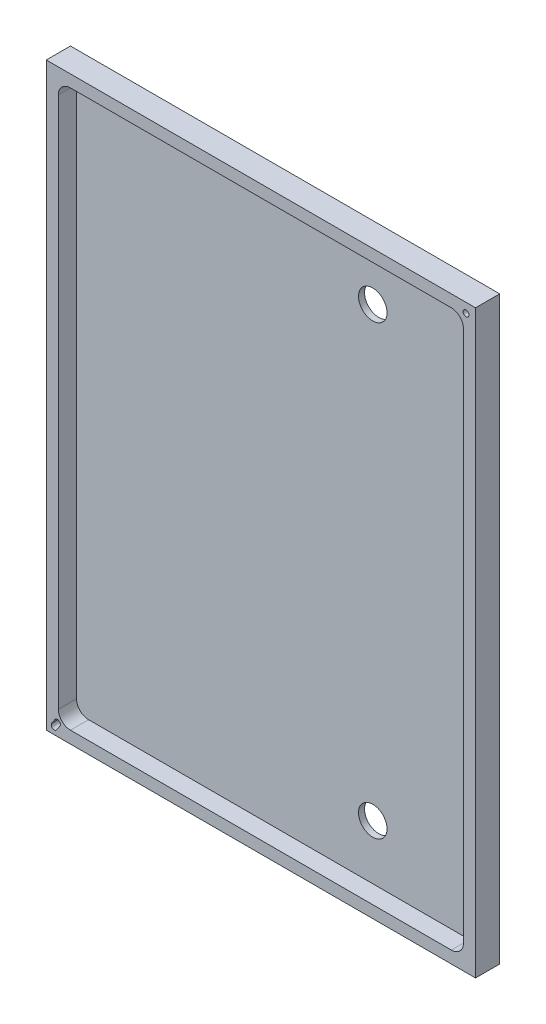
from build123d import *

# Parameters (mm, degrees)
SKETCH1_W                      = 225.425
SKETCH1_H                      = 304.8
BOSS_EXTRUDE1_DEPTH            = 12.7
CUT_EXTRUDE1_DEPTH             = 9.525
SKETCH4_R                      = 7.5
CUT_EXTRUDE3_DEPTH             = 190.976729249
F_3_1_3_1_DIAMETER_HOLE1_D     = 3.1
F_3_1_3_1_DIAMETER_HOLE1_DEPTH = 5
F_3_1_3_1_DIAMETER_HOLE1_TIP   = 0.931333959
CUT_EXTRUDE4_DEPTH             = 5
M4X0_7_TAPPED_HOLE1_D          = 3.3
M4X0_7_TAPPED_HOLE1_DEPTH      = 5.4
M4X0_7_TAPPED_HOLE1_TIP        = 0.991420021


with BuildPart() as part:
    # Sketch1 → Boss-Extrude1 (new body)
    with BuildSketch(Plane.XY):
        Rectangle(SKETCH1_W, SKETCH1_H)
    extrude(amount=BOSS_EXTRUDE1_DEPTH)

    # Sketch2 → Cut-Extrude1 (cut)
    with BuildSketch(Plane.XY.offset(12.7)):
        with BuildLine():
            Line((100.0125, -146.05), (-100.0125, -146.05))
            ThreePointArc((-100.0125, -146.05), (-104.502628061, -144.190128061), (-106.3625, -139.7))
            Line((-106.3625, -139.7), (-106.3625, 139.7))
            ThreePointArc((-106.3625, 139.7), (-104.502628061, 144.190128061), (-100.0125, 146.05))
            Line((-100.0125, 146.05), (100.0125, 146.05))
            ThreePointArc((100.0125, 146.05), (104.502628061, 144.190128061), (106.3625, 139.7))
            Line((106.3625, 139.7), (106.3625, -139.7))
            ThreePointArc((106.3625, -139.7), (104.502628061, -144.190128061), (100.0125, -146.05))
        make_face()
    extrude(amount=-CUT_EXTRUDE1_DEPTH, mode=Mode.SUBTRACT)

    # Sketch4 → Cut-Extrude3 (cut, through all)
    with BuildSketch(Plane(origin=(0, 0, 0), x_dir=(-1, 0, 0), z_dir=(0, 0, -1))):
        with Locations((-49.2125, -117.4)):
            Circle(SKETCH4_R)
        with Locations((-49.2125, 117.4)):
            Circle(SKETCH4_R)
    extrude(amount=-CUT_EXTRUDE3_DEPTH, mode=Mode.SUBTRACT)

    # Ø3.1 (3.1) Diameter Hole1
    with Locations(Plane.XY.offset(12.7)):
        with Locations((107.7125, 147.4)):
            Hole(F_3_1_3_1_DIAMETER_HOLE1_D / 2, depth=F_3_1_3_1_DIAMETER_HOLE1_DEPTH)
            with Locations((0, 0, -(F_3_1_3_1_DIAMETER_HOLE1_DEPTH + F_3_1_3_1_DIAMETER_HOLE1_TIP / 2))):  # 118° drill point
                Cone(0, F_3_1_3_1_DIAMETER_HOLE1_D / 2, F_3_1_3_1_DIAMETER_HOLE1_TIP, mode=Mode.SUBTRACT)

    # Sketch9 → Cut-Extrude4 (cut)
    with BuildSketch(Plane.XY.offset(12.7)):
        with BuildLine():
            Line((-109.832928502, -147.795326406), (-108.177117546, -145.29366894))
            ThreePointArc((-108.177117546, -145.29366894), (-106.029092195, -144.856648243), (-105.592071498, -147.004673594))
            Line((-105.592071498, -147.004673594), (-107.247882454, -149.50633106))
            ThreePointArc((-107.247882454, -149.50633106), (-109.395907805, -149.943351757), (-109.832928502, -147.795326406))
        make_face()
    extrude(amount=-CUT_EXTRUDE4_DEPTH, mode=Mode.SUBTRACT)

    # M4x0.7 Tapped Hole1
    with Locations(Plane(origin=(0, 0, 0), x_dir=(-1, 0, 0), z_dir=(0, 0, -1))):
        with Locations((109.5375, -113.6), (109.5375, 113.6)):
            Hole(M4X0_7_TAPPED_HOLE1_D / 2, depth=M4X0_7_TAPPED_HOLE1_DEPTH)
            with Locations((0, 0, -(M4X0_7_TAPPED_HOLE1_DEPTH + M4X0_7_TAPPED_HOLE1_TIP / 2))):  # 118° drill point
                Cone(0, M4X0_7_TAPPED_HOLE1_D / 2, M4X0_7_TAPPED_HOLE1_TIP, mode=Mode.SUBTRACT)


solid = part.part
